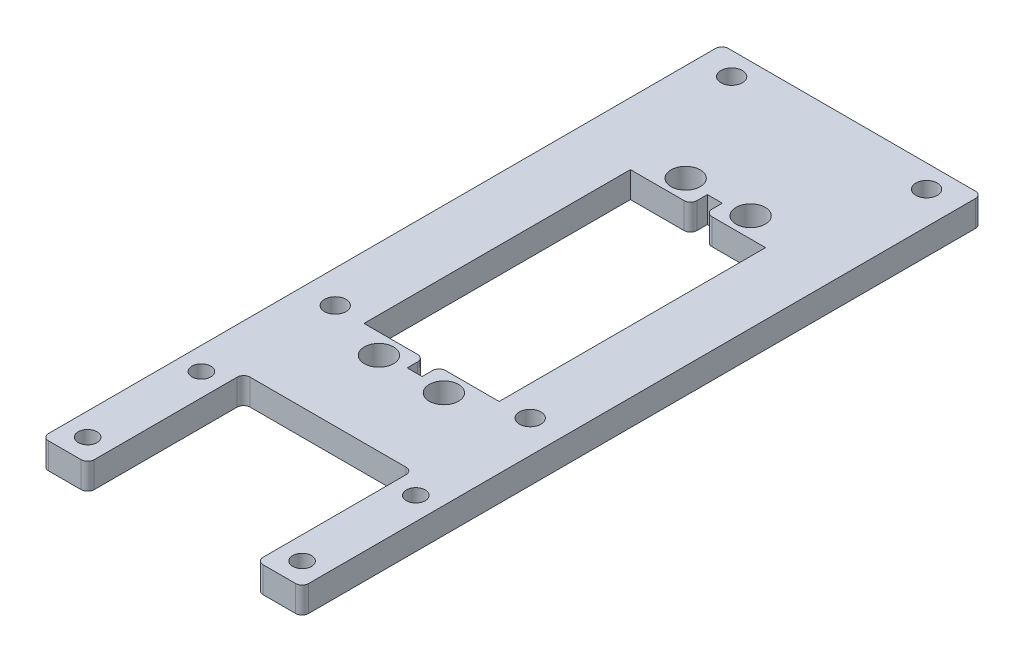
from build123d import *

# Parameters (mm, degrees)
SKETCH1_W           = 40
SKETCH1_H           = 104.6
BOSS_EXTRUDE1_DEPTH = 4
SKETCH2_R           = 1.65
CUT_EXTRUDE1_DEPTH  = 57.136351859
SKETCH3_R           = 2.25
CUT_EXTRUDE2_DEPTH  = 57.136351859
SKETCH4_R           = 1.45
SKETCH4_W           = 26
SKETCH4_H           = 24
CUT_EXTRUDE3_DEPTH  = 57.136351859
FILLET1_R           = 1


with BuildPart() as part:
    # Sketch1 → Boss-Extrude1 (new body)
    with BuildSketch(Plane(origin=(0, 0, 0), x_dir=(1, 0, 0), z_dir=(0, 1, 0))):
        Rectangle(SKETCH1_W, SKETCH1_H)
    extrude(amount=BOSS_EXTRUDE1_DEPTH)

    # Sketch2 → Cut-Extrude1 (cut, through all)
    with BuildSketch(Plane(origin=(0, 4, 0), x_dir=(1, 0, 0), z_dir=(0, 1, 0))):
        with Locations((-15, 48.8)):
            Circle(SKETCH2_R)
        with Locations((15, 48.8)):
            Circle(SKETCH2_R)
        with Locations((-15, -12.2)):
            Circle(SKETCH2_R)
        with Locations((15, -12.2)):
            Circle(SKETCH2_R)
    extrude(amount=-CUT_EXTRUDE1_DEPTH, mode=Mode.SUBTRACT)

    # Sketch3 → Cut-Extrude2 (cut, through all)
    with BuildSketch(Plane(origin=(0, 4, 0), x_dir=(1, 0, 0), z_dir=(0, 1, 0))):
        with Locations((-5, 31.71959884)):
            Circle(SKETCH3_R)
        with Locations((5, 31.71959884)):
            Circle(SKETCH3_R)
        with Locations((-5, -15.48040116)):
            Circle(SKETCH3_R)
        with Locations((5, -15.48040116)):
            Circle(SKETCH3_R)
        Polygon((-1.15, 31.21959884), (-1.15, 28.61959884), (-10.4, 28.61959884), (-10.4, -12.38040116), (-1.15, -12.38040116), (-1.15, -14.98040116), (1.15, -14.98040116), (1.15, -12.38040116), (10.4, -12.38040116), (10.4, 28.61959884), (1.15, 28.61959884), (1.15, 31.21959884), align=None)
    extrude(amount=-CUT_EXTRUDE2_DEPTH, mode=Mode.SUBTRACT)

    # Sketch4 → Cut-Extrude3 (cut, through all)
    with BuildSketch(Plane(origin=(0, 4, 0), x_dir=(1, 0, 0), z_dir=(0, 1, 0))):
        with Locations((-16.5, -31.3)):
            Circle(SKETCH4_R)
        with Locations((-16.5, -48.8)):
            Circle(SKETCH4_R)
        with Locations((16.5, -31.3)):
            Circle(SKETCH4_R)
        with Locations((16.5, -48.8)):
            Circle(SKETCH4_R)
        with Locations((0, -40.3)):
            Rectangle(SKETCH4_W, SKETCH4_H)
    extrude(amount=-CUT_EXTRUDE3_DEPTH, mode=Mode.SUBTRACT)

    # Fillet1
    fillet1_edges = [part.edges().sort_by_distance(p)[0] for p in [
        (1.15, 2, 12.38040116),
        (-1.15, 2, 12.38040116),
        (1.15, 2, -28.61959884),
        (-1.15, 2, -28.61959884),
        (-20, 2, -52.3),
        (20, 2, -52.3),
        (-13, 2, 28.3),
        (13, 2, 28.3),
        (20, 2, 52.3),
        (13, 2, 52.3),
        (-13, 2, 52.3),
        (-20, 2, 52.3),
    ]]
    fillet(fillet1_edges, radius=FILLET1_R)


solid = part.part
